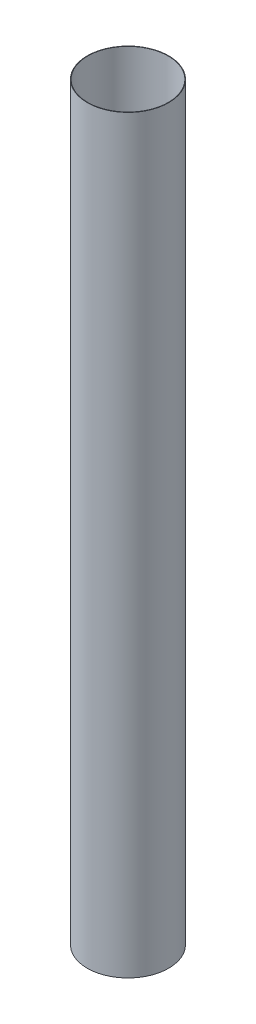
from build123d import *

# Parameters (mm, degrees)
SKETCH1_R           = 314.325
SKETCH1_R_2         = 311.15
BOSS_EXTRUDE1_DEPTH = 5791.2


with BuildPart() as part:
    # Sketch1 → Boss-Extrude1 (new body)
    with BuildSketch(Plane(origin=(0, 0, 0), x_dir=(1, 0, 0), z_dir=(0, 1, 0))):
        Circle(SKETCH1_R)
        Circle(SKETCH1_R_2, mode=Mode.SUBTRACT)
    extrude(amount=BOSS_EXTRUDE1_DEPTH)


solid = part.part
